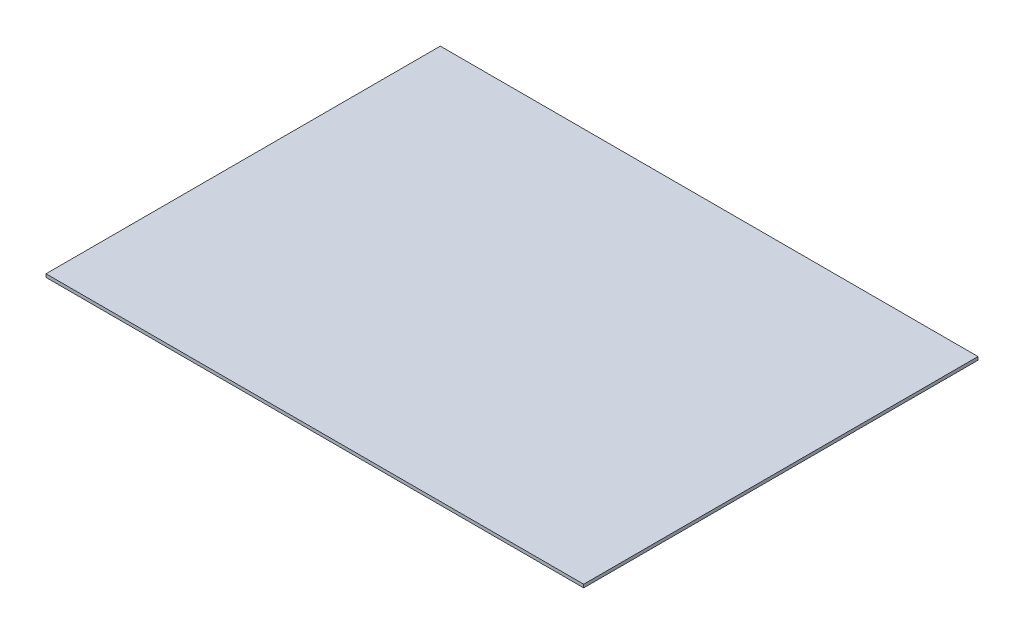
from build123d import *

# Parameters (mm, degrees)
SKETCH1_W           = 266.7
SKETCH1_H           = 195.58
BOSS_EXTRUDE1_DEPTH = 1.5875


with BuildPart() as part:
    # Sketch1 → Boss-Extrude1 (new body)
    with BuildSketch(Plane(origin=(0, 0, 0), x_dir=(1, 0, 0), z_dir=(0, 1, 0))):
        Rectangle(SKETCH1_W, SKETCH1_H)
    extrude(amount=BOSS_EXTRUDE1_DEPTH)


solid = part.part
